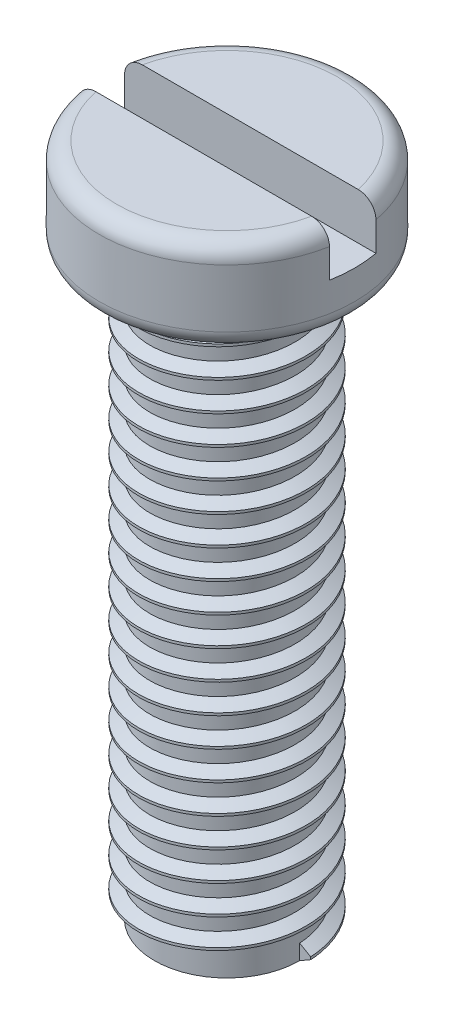
from build123d import *

# Parameters (mm, degrees)
SKETCH1_W           = 2.2
SKETCH1_H           = 1.6
FILLET1_R           = 0.3
SKETCH4_W           = 4.4
SKETCH4_H           = 0.8
CUT_EXTRUDE1_DEPTH  = 0.8
SKETCH3_R           = 1.25
BOSS_EXTRUDE1_DEPTH = 10
THREAD1_PITCH       = 0.5


with BuildPart() as part:
    # Sketch1 → Revolve1 (revolve)
    with BuildSketch(Plane.XY, mode=Mode.PRIVATE) as revolve1_sk:
        with Locations((1.1, 0.8)):
            Rectangle(SKETCH1_W, SKETCH1_H)
    revolve(revolve1_sk.sketch.rotate(Axis((0, 0, 0), (0, 1, 0)), 90), axis=Axis((0, 0, 0), (0, 1, 0)))

    # Fillet1
    fillet1_edges = [part.edges().sort_by_distance(p)[0] for p in [
        (0, 1.6, 2.2),
        (0, 0, 2.2),
    ]]
    fillet(fillet1_edges, radius=FILLET1_R)

    # Sketch4 → Cut-Extrude1 (cut)
    with BuildSketch(Plane(origin=(0, 1.6, 0), x_dir=(1, 0, 0), z_dir=(0, 1, 0))):
        Rectangle(SKETCH4_W, SKETCH4_H)
    extrude(amount=-CUT_EXTRUDE1_DEPTH, mode=Mode.SUBTRACT)

    # Sketch3 → Boss-Extrude1 (add)
    with BuildSketch(Plane.XZ):
        Circle(SKETCH3_R)
    extrude(amount=BOSS_EXTRUDE1_DEPTH)

    # Thread1: arcs per turn and ends read off the stored shape
    # Thread1: the profile of Thread Profile1 profile screwed along a right-hand helix through 20 turns, 6 arcs to a turn; built about Z, then put on its axis
    thread1_z = Axis((0, 0, 0), (0, 0, 1))
    thread1_corners = [(1.2497, 0, -10.000173205), (1.439443056, 0, -9.890625), (1.439443056, 0, -9.846875), (1.2497, 0, -9.737326796)]
    with BuildLine(mode=Mode.PRIVATE) as thread1_profile:
        Line(thread1_corners[0], thread1_corners[1])
        Line(thread1_corners[1], thread1_corners[2])
        Line(thread1_corners[2], thread1_corners[3])
        Line(thread1_corners[3], thread1_corners[0])
    thread1_cap = Face(thread1_profile.wire())
    thread1_turn_angles = [0, 30, 60, 90, 120, 150, 180, 210, 240, 270, 300, 330, 360]
    thread1_turn_weights = [1, 0.8660254037844387, 1, 0.8660254037844387, 1, 0.8660254037844387, 1, 0.8660254037844387, 1, 0.8660254037844387, 1, 0.8660254037844387, 1]
    thread1_turn_rails = [Edge.make_bspline([Vector(p[0], p[1], 0).rotate(thread1_z, thread1_turn_angles[k]) / thread1_turn_weights[k] + Vector(0, 0, p[2] + THREAD1_PITCH * thread1_turn_angles[k] / 360) for k in range(13)], [0, 0, 0, 1, 1, 2, 2, 3, 3, 4, 4, 5, 5, 6, 6, 6], 2, thread1_turn_weights) for p in thread1_corners]
    thread1_turn_sides = [Face.make_surface_from_curves(thread1_turn_rails[p[0]], thread1_turn_rails[p[1]]) for p in [(0, 1), (1, 2), (2, 3), (3, 0)]]
    thread1 = Plane(origin=(0, 0, 0), x_dir=(1, 0, 0), z_dir=(0, 1, 0)) * Solid(Shell([*[p.moved(Location((0, 0, THREAD1_PITCH * i))) for i in range(20) for p in thread1_turn_sides], thread1_cap, thread1_cap.rotate(thread1_z, 7200).moved(Location((0, 0, THREAD1_PITCH * 7200 / 360)))]))
    add(thread1)


solid = part.part
